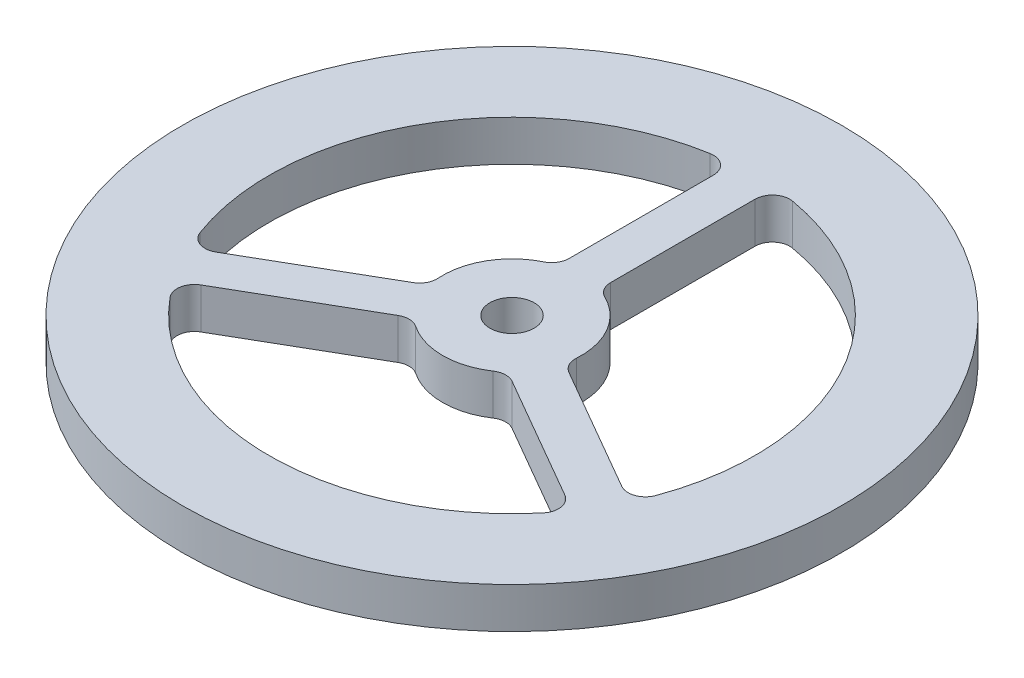
from build123d import *

# Parameters (mm, degrees)
SKETCH1_R           = 38
SKETCH1_R_2         = 2.55
BOSS_EXTRUDE1_DEPTH = 4.7


with BuildPart() as part:
    # Sketch1 → Boss-Extrude1 (new body)
    with BuildSketch(Plane(origin=(0, 0, 0), x_dir=(1, 0, 0), z_dir=(0, 1, 0))):
        Circle(SKETCH1_R)
        Circle(SKETCH1_R_2, mode=Mode.SUBTRACT)
        with BuildLine():
            Line((2.4, 8.979977728), (2.4, 25.624987805))
            ThreePointArc((2.4, 25.624987805), (3.110993227, 27.154190714), (4.738461538, 27.596140713))
            ThreePointArc((4.738461538, 27.596140713), (24.248711306, 14), (26.268189673, -9.694442289))
            ThreePointArc((26.268189673, -9.694442289), (25.071715591, -10.882896192), (23.391890411, -10.734032933))
            Line((23.391890411, -10.734032933), (8.976888838, -2.411527895))
            ThreePointArc((8.976888838, -2.411527895), (8.211845562, -1.620020671), (7.98151107, -0.54358167))
            ThreePointArc((7.98151107, -0.54358167), (6.92820323, 4), (3.52, 7.183982183))
            ThreePointArc((3.52, 7.183982183), (2.702943725, 7.921677204), (2.4, 8.979977728))
        make_face(mode=Mode.SUBTRACT)
        with BuildLine():
            Line((-2.4, 8.979977728), (-2.4, 25.624987805))
            ThreePointArc((-2.4, 25.624987805), (-3.110993227, 27.154190714), (-4.738461538, 27.596140713))
            ThreePointArc((-4.738461538, 27.596140713), (-24.248711306, 14), (-26.268189673, -9.694442289))
            ThreePointArc((-26.268189673, -9.694442289), (-25.071715591, -10.882896192), (-23.391890411, -10.734032933))
            Line((-23.391890411, -10.734032933), (-8.976888838, -2.411527895))
            ThreePointArc((-8.976888838, -2.411527895), (-8.211845562, -1.620020671), (-7.98151107, -0.54358167))
            ThreePointArc((-7.98151107, -0.54358167), (-6.92820323, 4), (-3.52, 7.183982183))
            ThreePointArc((-3.52, 7.183982183), (-2.702943725, 7.921677204), (-2.4, 8.979977728))
        make_face(mode=Mode.SUBTRACT)
        with BuildLine():
            Line((6.576888838, -6.568449833), (20.991890411, -14.890954872))
            ThreePointArc((20.991890411, -14.890954872), (21.960722365, -16.271294523), (21.529728135, -17.901698424))
            ThreePointArc((21.529728135, -17.901698424), (0, -28), (-21.529728135, -17.901698424))
            ThreePointArc((-21.529728135, -17.901698424), (-21.960722365, -16.271294523), (-20.991890411, -14.890954872))
            Line((-20.991890411, -14.890954872), (-6.576888838, -6.568449833))
            ThreePointArc((-6.576888838, -6.568449833), (-5.508901837, -6.301656533), (-4.46151107, -6.640400513))
            ThreePointArc((-4.46151107, -6.640400513), (0, -8), (4.46151107, -6.640400513))
            ThreePointArc((4.46151107, -6.640400513), (5.508901837, -6.301656533), (6.576888838, -6.568449833))
        make_face(mode=Mode.SUBTRACT)
    extrude(amount=BOSS_EXTRUDE1_DEPTH)


solid = part.part
